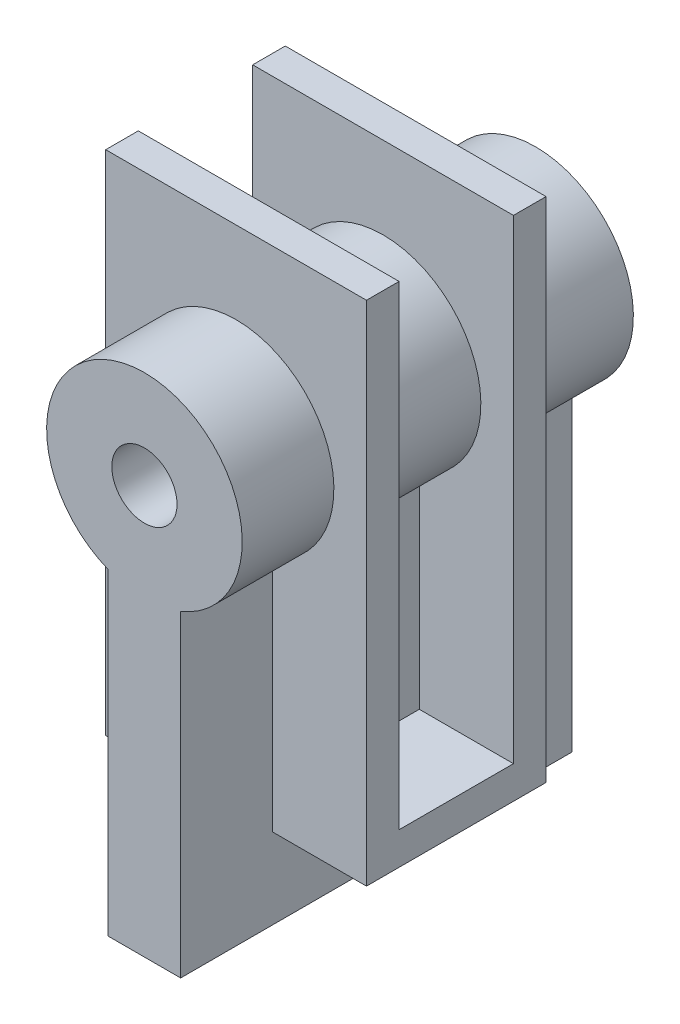
from build123d import *

# Parameters (mm, degrees)
EXTRUDE_5_DEPTH      = 30
EXTRUDE_5_DEPTH_BACK = 30
F_1_FR_R             = 5
EXTRUDE_6_DEPTH      = 20
EXTRUDE_6_DEPTH_BACK = 20


with BuildPart() as part:
    # Эскиз1_fr → Бобышка-Вытянуть5 (new, two sides: drawn at the far end of the back side and taken through both)
    with BuildSketch(Plane.XY.offset(-EXTRUDE_5_DEPTH_BACK)):
        with BuildLine():
            Line((-5.557606452, -13.932444528), (-5.557606452, -62.642280008))
            Line((-5.557606452, -62.642280008), (5.557606452, -62.642280008))
            Line((5.557606452, -62.642280008), (5.557606452, -13.932444528))
            ThreePointArc((5.557606452, -13.932444528), (0, 15), (-5.557606452, -13.932444528))
        make_face()
        Circle(F_1_FR_R, mode=Mode.SUBTRACT)
    extrude(amount=EXTRUDE_5_DEPTH + EXTRUDE_5_DEPTH_BACK)


with BuildPart() as body_2:
    # Эскиз3 → Бобышка-Вытянуть6 (new, two sides: drawn at the far end of the back side and taken through both)
    with BuildSketch(Plane(origin=(0, 0, 0), x_dir=(0, 0, -1), z_dir=(1, 0, 0)).offset(-EXTRUDE_6_DEPTH_BACK)):
        Polygon((-58.394498043, -50.25314581), (-85.938130262, -50.25314581), (-85.938130262, 27.580465306), (-80.938130262, 27.580465306), (-80.938130262, -45.25314581), (-63.394498043, -45.25314581), (-63.394498043, 27.580465306), (-58.394498043, 27.580465306), align=None)
    extrude(amount=EXTRUDE_6_DEPTH + EXTRUDE_6_DEPTH_BACK)


with BuildPart() as body_2_1:
    # Move Body 1: moved
    add(body_2.part.moved(Location((0, 0, -70))))


solid = Compound([part.part, body_2_1.part])
